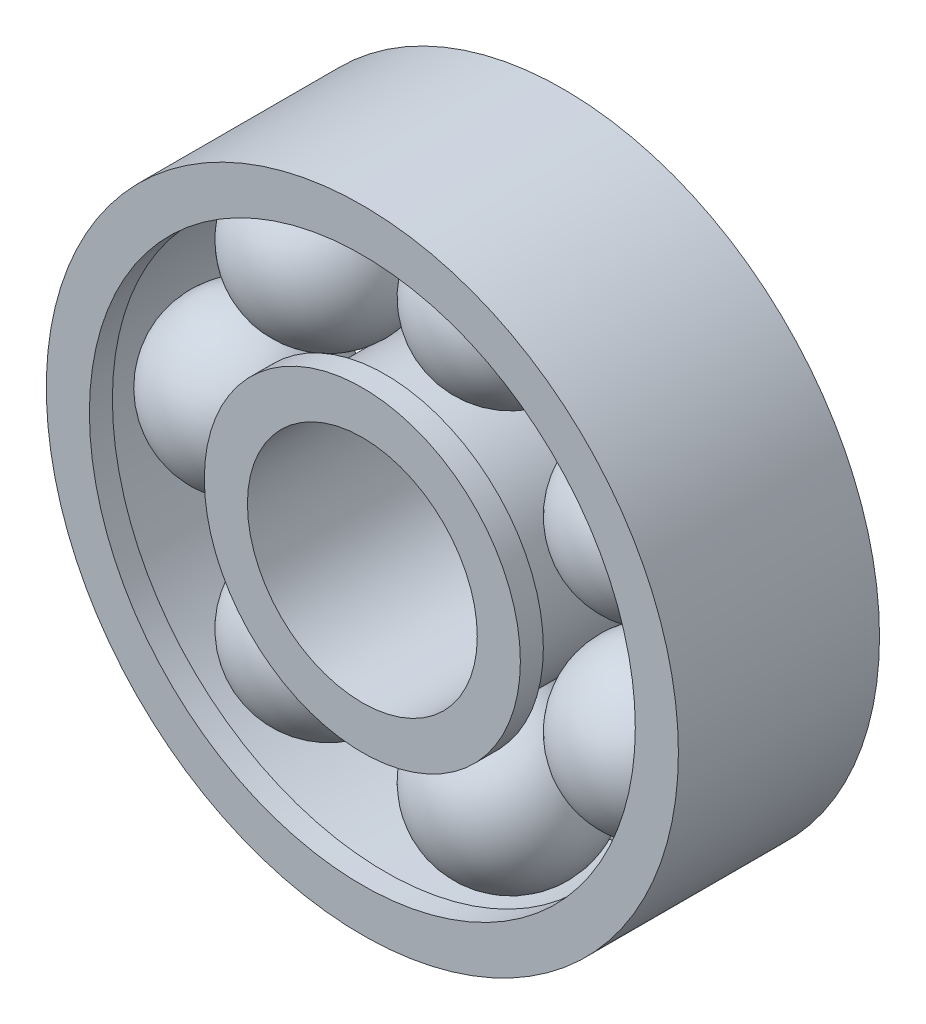
from build123d import *

# Parameters (mm, degrees)
BOSS_EXTRUDE1_DEPTH        = 3.5
BOSS_EXTRUDE1_DEPTH_BACK   = 3.5
SKETCH1_R                  = 5.5
SKETCH1_R_2                = 4
BOSS_EXTRUDE1_2_DEPTH      = 3.5
BOSS_EXTRUDE1_2_DEPTH_BACK = 3.5
SKETCH1_R_3                = 11
SKETCH1_R_4                = 9.5
CUT_EXTRUDE1_DEPTH         = 2.7
CUT_EXTRUDE1_DEPTH_BACK    = 2.7
SKETCH2_R                  = 10.3
SKETCH2_R_2                = 4.697673259


with BuildPart() as part:
    # Sketch1 → Boss-Extrude1 (new, two sides: drawn at the far end of the back side and taken through both)
    with BuildSketch(Plane.XY.offset(-BOSS_EXTRUDE1_DEPTH_BACK)):
        Circle(SKETCH1_R)
        Circle(SKETCH1_R_2, mode=Mode.SUBTRACT)
    extrude(amount=BOSS_EXTRUDE1_DEPTH + BOSS_EXTRUDE1_DEPTH_BACK)


with BuildPart() as body_2:
    # Sketch1 → Boss-Extrude1 2 (new, two sides: drawn at the far end of the back side and taken through both)
    with BuildSketch(Plane.XY.offset(-BOSS_EXTRUDE1_2_DEPTH_BACK)):
        Circle(SKETCH1_R_3)
        Circle(SKETCH1_R_4, mode=Mode.SUBTRACT)
    extrude(amount=BOSS_EXTRUDE1_2_DEPTH + BOSS_EXTRUDE1_2_DEPTH_BACK)


with BuildPart() as cut_extrude1_tool:
    # Sketch2 → Cut-Extrude1 (new, two sides: drawn at the far end of the back side and taken through both)
    with BuildSketch(Plane.XY.offset(-CUT_EXTRUDE1_DEPTH_BACK)):
        Circle(SKETCH2_R)
        Circle(SKETCH2_R_2, mode=Mode.SUBTRACT)
    extrude(amount=CUT_EXTRUDE1_DEPTH + CUT_EXTRUDE1_DEPTH_BACK)


with BuildPart() as part_1:
    add(part.part)

    # Cut-Extrude1: cut by cut_extrude1_tool
    add(cut_extrude1_tool.part, mode=Mode.SUBTRACT)


with BuildPart() as body_2_1:
    add(body_2.part)

    # Cut-Extrude1: cut by cut_extrude1_tool
    add(cut_extrude1_tool.part, mode=Mode.SUBTRACT)


with BuildPart() as body_3:
    # Sketch4 → Revolve2 (revolve)
    with BuildSketch(Plane.XY):
        with BuildLine():
            ThreePointArc((-7.498836629, -2.8), (-4.698836629, 0), (-7.498836629, 2.8))
            Line((-7.498836629, 2.8), (-7.498836629, -2.8))
        make_face()
    revolve(axis=Axis((-7.498836629, 0, 0), (0, 1, 0)))


with BuildPart() as body_4:
    # Sketch4<7> → Revolve3 (revolve)
    with BuildSketch(Plane.XY):
        with BuildLine():
            Line((-2.486320013, 7.608598004), (-4.675448164, 5.862826559))
            Line((-4.675448164, 5.862826559), (-6.864576315, 4.117055113))
            ThreePointArc((-6.864576315, 4.117055113), (-2.929676719, 3.673698408), (-2.486320013, 7.608598004))
        make_face()
    revolve(axis=Axis((-4.675448164, 5.862826559, 0), (0.7818314824680305, 0.6234898018587328, 0)))


with BuildPart() as body_5:
    # Sketch4<8> → Revolve4 (revolve)
    with BuildSketch(Plane.XY):
        with BuildLine():
            Line((4.398446284, 6.687766524), (1.66864813, 7.310825139))
            Line((1.66864813, 7.310825139), (-1.061150024, 7.933883754))
            ThreePointArc((-1.061150024, 7.933883754), (1.045589515, 4.581026985), (4.398446284, 6.687766524))
        make_face()
    revolve(axis=Axis((1.66864813, 7.310825139, 0), (0.974927912181823, -0.22252093395631764, 0)))


with BuildPart() as body_6:
    # Sketch4<9> → Revolve5 (revolve)
    with BuildSketch(Plane.XY):
        with BuildLine():
            Line((7.971092818, 0.730910446), (6.756218348, 3.253623276))
            Line((6.756218348, 3.253623276), (5.541343879, 5.776336106))
            ThreePointArc((5.541343879, 5.776336106), (4.233505518, 2.038748806), (7.971092818, 0.730910446))
        make_face()
    revolve(axis=Axis((6.756218348, 3.253623276, 0), (-0.4338837391175522, 0.900968867902422, 0)))


with BuildPart() as body_7:
    # Sketch4<10> → Revolve6 (revolve)
    with BuildSketch(Plane.XY):
        with BuildLine():
            Line((5.541343879, -5.776336106), (6.756218348, -3.253623276))
            Line((6.756218348, -3.253623276), (7.971092818, -0.730910446))
            ThreePointArc((7.971092818, -0.730910446), (4.233505518, -2.038748806), (5.541343879, -5.776336106))
        make_face()
    revolve(axis=Axis((6.756218348, -3.253623276, 0), (0.43388373911756595, 0.9009688679024154, 0)))


with BuildPart() as body_8:
    # Sketch4<11> → Revolve7 (revolve)
    with BuildSketch(Plane.XY):
        with BuildLine():
            Line((-1.061150024, -7.933883754), (1.66864813, -7.310825139))
            Line((1.66864813, -7.310825139), (4.398446284, -6.687766524))
            ThreePointArc((4.398446284, -6.687766524), (1.045589515, -4.581026985), (-1.061150024, -7.933883754))
        make_face()
    revolve(axis=Axis((1.66864813, -7.310825139, 0), (0.974927912181826, 0.2225209339563043, 0)))


with BuildPart() as body_9:
    # Sketch4<12> → Revolve8 (revolve)
    with BuildSketch(Plane.XY):
        with BuildLine():
            Line((-6.864576315, -4.117055113), (-4.675448164, -5.862826559))
            Line((-4.675448164, -5.862826559), (-2.486320013, -7.608598004))
            ThreePointArc((-2.486320013, -7.608598004), (-2.929676719, -3.673698408), (-6.864576315, -4.117055113))
        make_face()
    revolve(axis=Axis((-4.675448164, -5.862826559, 0), (-0.7818314824680226, 0.6234898018587426, 0)))


solid = Compound([part_1.part, body_2_1.part, body_3.part, body_4.part, body_5.part, body_6.part, body_7.part, body_8.part, body_9.part])
